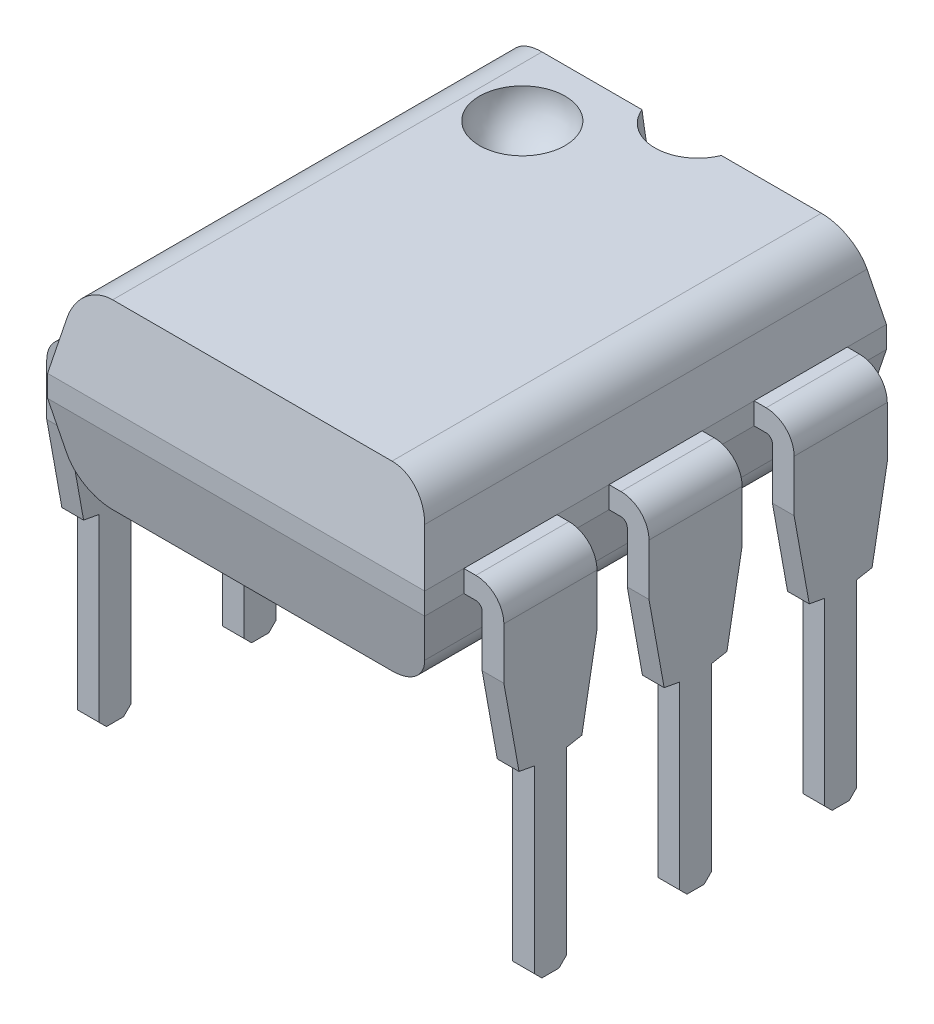
from build123d import *

# Parameters (mm, degrees)
BASE_EXTRUDE_DEPTH      = 6.58
BASE_EXTRUDE_DEPTH_BACK = 1.5
SKETCH1_W               = 6.6
SKETCH1_H               = 3.18
SKETCH2_OUTSIDE_W       = 10.782
SKETCH2_OUTSIDE_H       = 7.362
CUT_EXTRUDE1_DEPTH      = 12.593731065
SKETCH3_OUTSIDE_W       = 12.262
SKETCH3_OUTSIDE_H       = 7.362
CUT_EXTRUDE2_DEPTH      = 11.268032918
SKETCH5_W               = 1.63
SKETCH5_H               = 0.38
BOSS_EXTRUDE3_DEPTH     = 0.7
SKETCH6_W               = 0.38
SKETCH6_H               = 1.63
BOSS_EXTRUDE4_DEPTH     = 2.53
SKETCH4_W               = 0.38
SKETCH4_H               = 0.56
BOSS_EXTRUDE5_DEPTH     = 3.28
CUT_EXTRUDE5_DEPTH      = 0.38
FILLET1_R               = 0.49
FILLET2_R               = 0.11
FILLET1_OF_MIRROR1_R    = 0.49
FILLET2_OF_MIRROR1_R    = 0.11
LPATTERN1_START         = 0.3
LPATTERN1_OUTLINE_W     = 0.38
LPATTERN1_OUTLINE_H     = 1.63
LPATTERN1_DEPTH         = 7.02
LPATTERN1_START_2       = 1.725
LPATTERN1_2_DEPTH       = 1.63
LPATTERN1_START_3       = 4.265
LPATTERN1_3_DEPTH       = 1.63
LPATTERN1_START_4       = -0.19
LPATTERN1_4_DEPTH       = 0.38
LPATTERN1_START_5       = 7.43
LPATTERN1_5_DEPTH       = 0.38
SKETCH9_R               = 0.75
CUT_EXTRUDE6_DEPTH      = 0.7


with BuildPart() as part:
    # Sketch1 → Base-Extrude (new, two sides: drawn at the far end of the back side and taken through both)
    with BuildSketch(Plane.XY.offset(-BASE_EXTRUDE_DEPTH_BACK)):
        with Locations((3.81, 2.72)):
            Rectangle(SKETCH1_W, SKETCH1_H)
    extrude(amount=BASE_EXTRUDE_DEPTH + BASE_EXTRUDE_DEPTH_BACK)

    # Sketch2 outside → Cut-Extrude1 (cut, through all)
    with BuildSketch(Plane.XY.offset(6.58)):
        with Locations((3.81, 2.72)):
            Rectangle(SKETCH2_OUTSIDE_W, SKETCH2_OUTSIDE_H)
        with BuildLine():
            Line((0.51, 2.91), (0.679431307, 3.748623606))
            ThreePointArc((0.679431307, 3.748623606), (0.922305346, 4.151773257), (1.365567952, 4.31))
            Line((1.365567952, 4.31), (6.254432048, 4.31))
            ThreePointArc((6.254432048, 4.31), (6.697694654, 4.151773257), (6.940568693, 3.748623606))
            Line((6.940568693, 3.748623606), (7.11, 2.91))
            Line((7.11, 2.91), (7.11, 2.53))
            Line((7.11, 2.53), (6.940568693, 1.691376394))
            ThreePointArc((6.940568693, 1.691376394), (6.697694654, 1.288226743), (6.254432048, 1.13))
            Line((6.254432048, 1.13), (1.365567952, 1.13))
            ThreePointArc((1.365567952, 1.13), (0.922305346, 1.288226743), (0.679431307, 1.691376394))
            Line((0.679431307, 1.691376394), (0.51, 2.53))
            Line((0.51, 2.53), (0.51, 2.91))
        make_face(mode=Mode.SUBTRACT)
    extrude(amount=-CUT_EXTRUDE1_DEPTH, mode=Mode.SUBTRACT)

    # Sketch3 outside → Cut-Extrude2 (cut, through all)
    with BuildSketch(Plane(origin=(7.11, 0, 0), x_dir=(0, 0, -1), z_dir=(1, 0, 0))):
        with Locations((-2.54, 2.72)):
            Rectangle(SKETCH3_OUTSIDE_W, SKETCH3_OUTSIDE_H)
        Polygon((1.5, 2.91), (1.134316679, 4.72), (-6.214316679, 4.72), (-6.58, 2.91), (-6.58, 2.53), (-6.214316679, 0.72), (1.134316679, 0.72), (1.5, 2.53), align=None, mode=Mode.SUBTRACT)
    extrude(amount=-CUT_EXTRUDE2_DEPTH, mode=Mode.SUBTRACT)

    # Sketch5 → Boss-Extrude3 (add)
    with BuildSketch(Plane.ZY.offset(-0.51)):
        with Locations((0, 2.72)):
            Rectangle(SKETCH5_W, SKETCH5_H)
    boss_extrude3 = extrude(amount=BOSS_EXTRUDE3_DEPTH)

    # Sketch8 → Cut-Revolve1 (revolve, cut)
    with BuildSketch(Plane.XY):
        with BuildLine():
            Line((2.237663013, 3.56), (2.237663013, 4.31))
            Line((2.237663013, 4.31), (2.987663013, 4.31))
            ThreePointArc((2.987663013, 4.31), (2.767993099, 3.779669914), (2.237663013, 3.56))
        make_face()
    revolve(axis=Axis((2.237663013, 4.928970116, 0), (0, -1, 0)), mode=Mode.SUBTRACT)

    # Sketch6 → Boss-Extrude4 (add)
    with BuildSketch(Plane.XZ.offset(-2.53)):
        Rectangle(SKETCH6_W, SKETCH6_H)
    boss_extrude4 = extrude(amount=BOSS_EXTRUDE4_DEPTH)

    # Sketch4 → Boss-Extrude5 (add)
    with BuildSketch(Plane(origin=(0, 0, 0), x_dir=(1, 0, 0), z_dir=(0, 1, 0))):
        Rectangle(SKETCH4_W, SKETCH4_H)
    boss_extrude5 = extrude(amount=-BOSS_EXTRUDE5_DEPTH)

    # Sketch7 → Cut-Extrude5 (cut)
    with BuildSketch(Plane.ZY.offset(0.19)):
        Polygon((0.815, 1.52), (0.55, 0.05), (0.28, 0), (0.28, -3.15), (0.15, -3.28), (-0.15, -3.28), (-0.28, -3.15), (-0.28, 0), (-0.55, 0.05), (-0.815, 1.52), (-0.815, -3.78), (0.815, -3.78), align=None)
    cut_extrude5 = extrude(amount=-CUT_EXTRUDE5_DEPTH, mode=Mode.SUBTRACT)

    # Fillet1
    fillet1_edges = [part.edges().sort_by_distance(p)[0] for p in [
        (-0.19, 2.91, 0),
    ]]
    fillet(fillet1_edges, radius=FILLET1_R)

    # Fillet2
    fillet2_edges = [part.edges().sort_by_distance(p)[0] for p in [
        (0.19, 2.53, 0),
    ]]
    fillet(fillet2_edges, radius=FILLET2_R)

    # Mirror1: Boss-Extrude3, Boss-Extrude4, Boss-Extrude5, Cut-Extrude5 across plane
    add(boss_extrude3.mirror(Plane.ZY.offset(-3.81)))
    add(boss_extrude4.mirror(Plane.ZY.offset(-3.81)))
    add(boss_extrude5.mirror(Plane.ZY.offset(-3.81)))
    add(cut_extrude5.mirror(Plane.ZY.offset(-3.81)), mode=Mode.SUBTRACT)

    # Fillet1 of Mirror1
    fillet1_of_mirror1_edges = [part.edges().sort_by_distance(p)[0] for p in [
        (7.81, 2.91, 0),
    ]]
    fillet(fillet1_of_mirror1_edges, radius=FILLET1_OF_MIRROR1_R)

    # Fillet2 of Mirror1
    fillet2_of_mirror1_edges = [part.edges().sort_by_distance(p)[0] for p in [
        (7.43, 2.53, 0),
    ]]
    fillet(fillet2_of_mirror1_edges, radius=FILLET2_OF_MIRROR1_R)

    # LPattern1: read off the stored shape, not the designer's step
    # LPattern1 outline → LPattern1 (add)
    with BuildSketch(Plane.YZ.offset(LPATTERN1_START)):
        with Locations((2.72, 5.08)):
            Rectangle(LPATTERN1_OUTLINE_W, LPATTERN1_OUTLINE_H)
        with Locations((2.72, 2.54)):
            Rectangle(LPATTERN1_OUTLINE_W, LPATTERN1_OUTLINE_H)
    extrude(amount=LPATTERN1_DEPTH)

    # LPattern1 2 outline → LPattern1 2 (add)
    with BuildSketch(Plane.XY.offset(LPATTERN1_START_2)):
        with BuildLine():
            Line((7.43, -3.28), (7.81, -3.28))
            Line((7.81, -3.28), (7.81, 2.42))
            ThreePointArc((7.81, 2.42), (7.666482323, 2.766482323), (7.32, 2.91))
            Line((7.32, 2.91), (7.32, 2.53))
            ThreePointArc((7.32, 2.53), (7.397781746, 2.497781746), (7.43, 2.42))
            Line((7.43, 2.42), (7.43, -3.28))
        make_face()
        with BuildLine():
            Line((-0.19, 2.42), (-0.19, -3.28))
            Line((-0.19, -3.28), (0.19, -3.28))
            Line((0.19, -3.28), (0.19, 2.42))
            ThreePointArc((0.19, 2.42), (0.222218254, 2.497781746), (0.3, 2.53))
            Line((0.3, 2.53), (0.3, 2.91))
            ThreePointArc((0.3, 2.91), (-0.046482323, 2.766482323), (-0.19, 2.42))
        make_face()
    extrude(amount=LPATTERN1_2_DEPTH)

    # LPattern1 3 outline → LPattern1 3 (add)
    with BuildSketch(Plane.XY.offset(LPATTERN1_START_3)):
        with BuildLine():
            Line((7.43, -3.28), (7.81, -3.28))
            Line((7.81, -3.28), (7.81, 2.42))
            ThreePointArc((7.81, 2.42), (7.666482323, 2.766482323), (7.32, 2.91))
            Line((7.32, 2.91), (7.32, 2.53))
            ThreePointArc((7.32, 2.53), (7.397781746, 2.497781746), (7.43, 2.42))
            Line((7.43, 2.42), (7.43, -3.28))
        make_face()
        with BuildLine():
            Line((-0.19, 2.42), (-0.19, -3.28))
            Line((-0.19, -3.28), (0.19, -3.28))
            Line((0.19, -3.28), (0.19, 2.42))
            ThreePointArc((0.19, 2.42), (0.222218254, 2.497781746), (0.3, 2.53))
            Line((0.3, 2.53), (0.3, 2.91))
            ThreePointArc((0.3, 2.91), (-0.046482323, 2.766482323), (-0.19, 2.42))
        make_face()
    extrude(amount=LPATTERN1_3_DEPTH)

    # LPattern1 4 outline → LPattern1 4 (cut)
    with BuildSketch(Plane.YZ.offset(LPATTERN1_START_4)):
        Polygon((-3.28, 5.23), (-3.15, 5.36), (0, 5.36), (0.05, 5.63), (1.52, 5.895), (-3.28, 5.895), align=None)
        Polygon((-3.15, 4.8), (-3.28, 4.93), (-3.28, 4.265), (1.52, 4.265), (0.05, 4.53), (0, 4.8), align=None)
        Polygon((-3.28, 2.69), (-3.15, 2.82), (0, 2.82), (0.05, 3.09), (1.52, 3.355), (-3.28, 3.355), align=None)
        Polygon((-3.15, 2.26), (-3.28, 2.39), (-3.28, 1.725), (1.52, 1.725), (0.05, 1.99), (0, 2.26), align=None)
    extrude(amount=LPATTERN1_4_DEPTH, mode=Mode.SUBTRACT)

    # LPattern1 5 outline → LPattern1 5 (cut)
    with BuildSketch(Plane.YZ.offset(LPATTERN1_START_5)):
        Polygon((-3.28, 5.23), (-3.15, 5.36), (0, 5.36), (0.05, 5.63), (1.52, 5.895), (-3.28, 5.895), align=None)
        Polygon((-3.15, 4.8), (-3.28, 4.93), (-3.28, 4.265), (1.52, 4.265), (0.05, 4.53), (0, 4.8), align=None)
        Polygon((-3.28, 2.69), (-3.15, 2.82), (0, 2.82), (0.05, 3.09), (1.52, 3.355), (-3.28, 3.355), align=None)
        Polygon((-3.15, 2.26), (-3.28, 2.39), (-3.28, 1.725), (1.52, 1.725), (0.05, 1.99), (0, 2.26), align=None)
    extrude(amount=LPATTERN1_5_DEPTH, mode=Mode.SUBTRACT)

    # Sketch9 → Cut-Extrude6 (cut)
    with BuildSketch(Plane(origin=(0, 4.31, 0), x_dir=(-1, 0, 0), z_dir=(0, 1, 0))):
        with Locations((-3.81, -1.5)):
            Circle(SKETCH9_R)
    extrude(amount=-CUT_EXTRUDE6_DEPTH, mode=Mode.SUBTRACT)


solid = part.part
